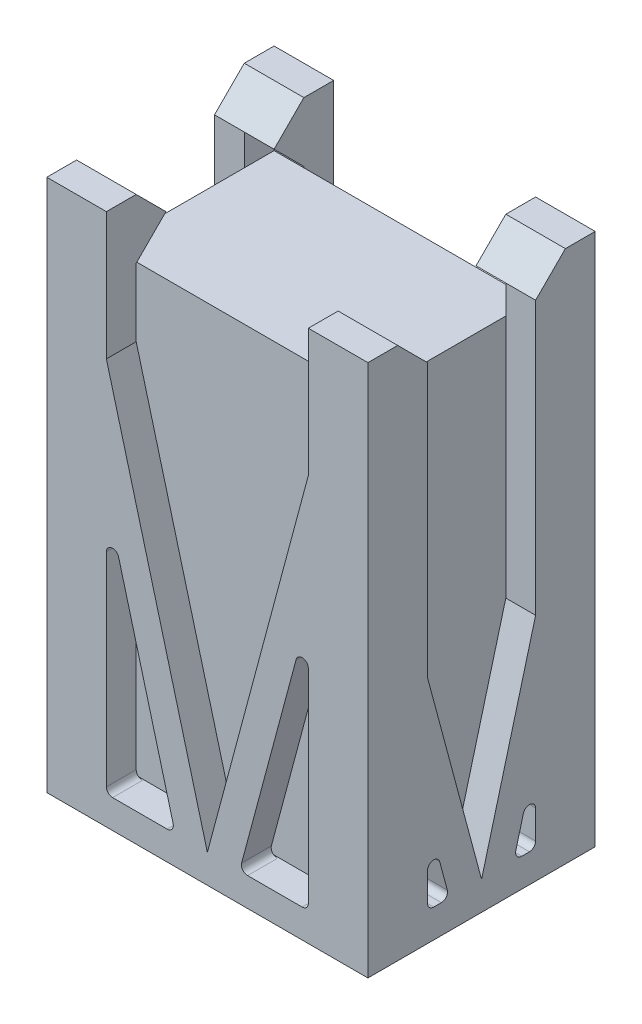
from build123d import *

# Parameters (mm, degrees)
SKETCH1_W                                 = 32.850000086
SKETCH1_H                                 = 23.249999982
BOSS_EXTRUDE1_DEPTH                       = 3.175
SKETCH2_W                                 = 26.500000086
SKETCH2_H                                 = 16.899999982
BATTERY_DEPTH                             = 45.499999932
CSK_FOR_4_FLAT_HEAD_MACHINE_SCREW_2_COUNT = 2
CSK_FOR_4_FLAT_HEAD_MACHINE_SCREW_2_PITCH = 19.05
BOSS_EXTRUDE4_DEPTH                       = 45.499999932
RIB1_START                                = -3.048
RIB1_DEPTH                                = 3.048
CUT_EXTRUDE1_DEPTH                        = 3.048
MIRROR2_START                             = -3.048
MIRROR2_COPY_1_DEPTH                      = 3.048
MIRROR2_COPY_2_DEPTH                      = 3.048
BOSS_EXTRUDE5_REACH                       = 61.862
BOSS_EXTRUDE6_DEPTH                       = 3.048
BOSS_EXTRUDE7_DEPTH                       = 6.096
BOSS_EXTRUDE8_DEPTH                       = 3.048
RIB4_REACH                                = 66.916
SKETCH22_WALL_W                           = 153.195008736
SKETCH22_WALL_H                           = 3.048
CUT_EXTRUDE2_DEPTH                        = 3.048
MIRROR7_COPY_1_REACH                      = 66.916
MIRROR7_COPY_1_SKETCH_W                   = 153.195008736
MIRROR7_COPY_1_SKETCH_H                   = 3.048
MIRROR7_COPY_2_DEPTH                      = 3.048
FILLET2_R                                 = 0.635
CHAMFER_FOR_ELEPHANT_S_FOOT_SIZE          = 0.254


# Read off the part's stored shape, not the designer's step: Rib1
with BuildPart() as part:
    # Sketch1 → Boss-Extrude1 (new body)
    with BuildSketch(Plane(origin=(0, 0, 0), x_dir=(1, 0, 0), z_dir=(0, 1, 0))):
        Rectangle(SKETCH1_W, SKETCH1_H)
    extrude(amount=BOSS_EXTRUDE1_DEPTH)

    # Sketch13 → CSK for _4 Flat Head Machine Screw _100 (revolve, cut)
    with BuildSketch(Plane(origin=(-9.525, 3.175, 0), x_dir=(0, 0, 1), z_dir=(1, 0, 0))):
        Polygon((0, 0), (0, 3.175), (1.63195, 3.175), (1.63195, 1.028358553), (2.8575, 0), align=None)
    csk_for_4_flat_head_machine_screw_100 = revolve(axis=Axis((-9.525, 9.525, 0), (0, -1, 0)), mode=Mode.SUBTRACT)

    # CSK for _4 Flat Head Machine Screw _ 2: CSK for _4 Flat Head Machine Screw _100 ×2
    with Locations(*[(i * CSK_FOR_4_FLAT_HEAD_MACHINE_SCREW_2_PITCH, 0, 0) for i in range(1, CSK_FOR_4_FLAT_HEAD_MACHINE_SCREW_2_COUNT)]):
        add(csk_for_4_flat_head_machine_screw_100, mode=Mode.SUBTRACT)

    # Sketch14 → Boss-Extrude4 (add)
    with BuildSketch(Plane(origin=(0, 3.175, 0), x_dir=(1, 0, 0), z_dir=(0, 1, 0))):
        Polygon((16.425000043, -11.624999991), (16.425000043, -5.528999991), (13.377000043, -5.528999991), (13.377000043, -8.576999991), (10.329000043, -8.576999991), (10.329000043, -11.624999991), align=None)
        Polygon((13.377000043, 8.576999991), (13.377000043, 5.528999991), (16.425000043, 5.528999991), (16.425000043, 11.624999991), (10.329000043, 11.624999991), (10.329000043, 8.576999991), align=None)
        Polygon((-10.329000043, 8.576999991), (-10.329000043, 11.624999991), (-16.425000043, 11.624999991), (-16.425000043, 5.528999991), (-13.377000043, 5.528999991), (-13.377000043, 8.576999991), align=None)
        Polygon((-16.425000043, -11.624999991), (-10.329000043, -11.624999991), (-10.329000043, -8.576999991), (-13.377000043, -8.576999991), (-13.377000043, -5.528999991), (-16.425000043, -5.528999991), align=None)
    extrude(amount=BOSS_EXTRUDE4_DEPTH)

    # Rib1 outline → Rib1 (add)
    with BuildSketch(Plane.XY.offset(11.624999991).offset(RIB1_START)):
        Polygon((-10.329000043, 3.175), (0, 3.175), (-10.329000043, 41.723352952), align=None)
    rib1 = extrude(amount=RIB1_DEPTH)

    # Sketch18 → Cut-Extrude1 (cut)
    with BuildSketch(Plane(origin=(0, 0, 8.576999991), x_dir=(-1, 0, 0), z_dir=(0, 0, -1))):
        Polygon((10.329000043, 29.456094958), (10.329000043, 3.175), (3.287001873, 3.175), align=None)
    cut_extrude1 = extrude(amount=-CUT_EXTRUDE1_DEPTH, mode=Mode.SUBTRACT)

    # Mirror1: Rib1, Cut-Extrude1 across plane
    add(rib1.mirror(Plane.XY))
    add(cut_extrude1.mirror(Plane.XY), mode=Mode.SUBTRACT)

    # Mirror2: Rib1, Cut-Extrude1 across plane
    add(rib1.mirror(Plane(origin=(0, 0, 0), x_dir=(0, 0, 1), z_dir=(1, 0, 0))))
    add(cut_extrude1.mirror(Plane(origin=(0, 0, 0), x_dir=(0, 0, 1), z_dir=(1, 0, 0))), mode=Mode.SUBTRACT)

    # Mirror2 copy 1 sketch → Mirror2 copy 1 (add)
    with BuildSketch(Plane(origin=(0, 0, -11.624999991), x_dir=(-1, 0, 0), z_dir=(0, 0, -1)).offset(MIRROR2_START)):
        Polygon((-10.329000043, 3.175), (0, 3.175), (-10.329000043, 41.723352952), align=None)
    extrude(amount=MIRROR2_COPY_1_DEPTH)

    # Mirror2 copy 2 sketch → Mirror2 copy 2 (cut)
    with BuildSketch(Plane.XY.offset(-8.576999991)):
        Polygon((10.329000043, 29.456094958), (10.329000043, 3.175), (3.287001873, 3.175), align=None)
    extrude(amount=-MIRROR2_COPY_2_DEPTH, mode=Mode.SUBTRACT)

    # Boss-Extrude5: up to this face of the body (flat: up to its plane)
    boss_extrude5_end = Plane(part.part.faces().sort_by_distance((10.329000043, 45.199176442, 10.100999991))[0])
    # Sketch19 → Boss-Extrude5 (add, up to the picked face)
    with BuildSketch(Plane.ZY.offset(-16.425000043), mode=Mode.PRIVATE) as boss_extrude5_sk1:
        Polygon((5.528999991, 51.722999932), (8.576999991, 48.674999932), (11.624999991, 48.674999932), (11.624999991, 51.722999932), align=None)
    boss_extrude5_tool1 = split(extrude(boss_extrude5_sk1.sketch, amount=BOSS_EXTRUDE5_REACH, mode=Mode.PRIVATE), bisect_by=boss_extrude5_end, keep=Keep.BOTH, mode=Mode.PRIVATE)
    # Sketch19 → Boss-Extrude5 (add, up to the picked face)
    with BuildSketch(Plane.ZY.offset(-16.425000043), mode=Mode.PRIVATE) as boss_extrude5_sk2:
        Polygon((8.576999991, 54.770999932), (5.528999991, 51.722999932), (11.624999991, 51.722999932), (11.624999991, 54.770999932), align=None)
    boss_extrude5_tool2 = split(extrude(boss_extrude5_sk2.sketch, amount=BOSS_EXTRUDE5_REACH, mode=Mode.PRIVATE), bisect_by=boss_extrude5_end, keep=Keep.BOTH, mode=Mode.PRIVATE)
    boss_extrude5_1 = boss_extrude5_tool1.solids().sort_by(Axis((16.425, 50.368333, 9.254333), (-1, 0, 0)))[0]
    add(boss_extrude5_1)
    boss_extrude5_2 = boss_extrude5_tool2.solids().sort_by(Axis((16.425, 53.077667, 9.254333), (-1, 0, 0)))[0]
    add(boss_extrude5_2)
    boss_extrude5 = boss_extrude5_1 + boss_extrude5_2  # Boss-Extrude5 as one shape, for the pattern or mirror that repeats it

    # Sketch19<3> → Boss-Extrude6 (add)
    with BuildSketch(Plane.ZY.offset(-16.425000043)):
        Polygon((5.528999991, 48.674999932), (8.576999991, 48.674999932), (5.528999991, 51.722999932), align=None)
    boss_extrude6 = extrude(amount=BOSS_EXTRUDE6_DEPTH)

    # Sketch20 → Boss-Extrude7 (add)
    with BuildSketch(Plane.ZY.offset(16.425000043)):
        Polygon((8.576999991, 54.770999932), (5.528999991, 51.722999932), (8.576999991, 48.674999932), (11.624999991, 48.674999932), (11.624999991, 54.770999932), align=None)
    boss_extrude7 = extrude(amount=-BOSS_EXTRUDE7_DEPTH)

    # Sketch20<3> → Boss-Extrude8 (add)
    with BuildSketch(Plane.ZY.offset(16.425000043)):
        Polygon((5.528999991, 51.722999932), (5.528999991, 48.674999932), (8.576999991, 48.674999932), align=None)
    boss_extrude8 = extrude(amount=-BOSS_EXTRUDE8_DEPTH)

    # Mirror3: Boss-Extrude5, Boss-Extrude6, Boss-Extrude7, Boss-Extrude8 across plane
    add(boss_extrude5.mirror(Plane.XY))
    add(boss_extrude6.mirror(Plane.XY))
    add(boss_extrude7.mirror(Plane.XY))
    add(boss_extrude8.mirror(Plane.XY))

    # Sketch22 wall → Rib4 (add, up to next)
    with BuildSketch(Plane(origin=(16.425000043, 13.492254441, 2.764499996), x_dir=(0, 0.965925826288, 0.258819045108), z_dir=(0, -0.258819045108, 0.965925826288)), mode=Mode.PRIVATE) as rib4_sk1:
        with Locations((0, 1.524)):
            Rectangle(SKETCH22_WALL_W, SKETCH22_WALL_H)
    rib4_tool1 = extrude(rib4_sk1.sketch, amount=RIB4_REACH, mode=Mode.PRIVATE) - part.part
    rib4 = rib4_tool1.solids().sort_by_distance((16.425000043, 13.492254441, 2.764499996))[0]
    add(rib4)

    # Sketch23 → Cut-Extrude2 (cut)
    with BuildSketch(Plane(origin=(16.425000043, 0, 0), x_dir=(0, 0, -1), z_dir=(1, 0, 0))):
        Polygon((-5.528999991, 3.175), (-3.287001873, 3.175), (-5.528999991, 11.542250888), align=None)
    cut_extrude2 = extrude(amount=-CUT_EXTRUDE2_DEPTH, mode=Mode.SUBTRACT)

    # Mirror6: Rib4, Cut-Extrude2 across plane
    add(rib4.mirror(Plane(origin=(0, 0, 0), x_dir=(0, 0, 1), z_dir=(1, 0, 0))))
    add(cut_extrude2.mirror(Plane(origin=(0, 0, 0), x_dir=(0, 0, 1), z_dir=(1, 0, 0))), mode=Mode.SUBTRACT)

    # Mirror7: Rib4, Cut-Extrude2 across plane
    add(rib4.mirror(Plane.XY))
    add(cut_extrude2.mirror(Plane.XY), mode=Mode.SUBTRACT)

    # Mirror7 copy 1 sketch → Mirror7 copy 1 (add, up to next)
    with BuildSketch(Plane(origin=(-16.425000043, 13.492254441, -2.764499996), x_dir=(0, 0.965925826288, -0.258819045108), z_dir=(0, -0.258819045108, -0.965925826288)), mode=Mode.PRIVATE) as mirror7_copy_1_sk1:
        with Locations((0, 1.524)):
            Rectangle(MIRROR7_COPY_1_SKETCH_W, MIRROR7_COPY_1_SKETCH_H)
    mirror7_copy_1_tool1 = extrude(mirror7_copy_1_sk1.sketch, amount=MIRROR7_COPY_1_REACH, mode=Mode.PRIVATE) - part.part
    add(mirror7_copy_1_tool1.solids().sort_by_distance((-16.425000043, 13.492254441, -2.764499996))[0])

    # Mirror7 copy 2 sketch → Mirror7 copy 2 (cut)
    with BuildSketch(Plane.ZY.offset(16.425000043)):
        Polygon((-5.528999991, 3.175), (-3.287001873, 3.175), (-5.528999991, 11.542250888), align=None)
    extrude(amount=-MIRROR7_COPY_2_DEPTH, mode=Mode.SUBTRACT)

    # Fillet2
    fillet2_edges = [part.edges().sort_by_distance(p)[0] for p in [
        (-3.287001873, 3.175, 10.100999991),
        (-10.329000043, 29.456094958, 10.100999991),
        (-10.329000043, 3.175, 10.100999991),
        (0, 3.175, -10.100999991),
        (-10.329000043, 29.456094958, -10.100999991),
        (-3.287001873, 3.175, -10.100999991),
        (-10.329000043, 3.175, -10.100999991),
        (10.329000043, 29.456094958, 10.100999991),
        (3.287001873, 3.175, 10.100999991),
        (10.329000043, 3.175, 10.100999991),
        (3.287001873, 3.175, -10.100999991),
        (10.329000043, 29.456094958, -10.100999991),
        (10.329000043, 3.175, -10.100999991),
        (14.901000043, 3.175, 5.528999991),
        (14.901000043, 11.542250888, 5.528999991),
        (14.901000043, 3.175, 3.287001873),
        (-14.901000043, 11.542250888, 5.528999991),
        (-14.901000043, 3.175, 5.528999991),
        (-14.901000043, 3.175, 3.287001873),
        (-14.901000043, 3.175, -5.528999991),
        (-14.901000043, 11.542250888, -5.528999991),
        (-14.901000043, 3.175, -3.287001873),
        (14.901000043, 11.542250888, -5.528999991),
        (14.901000043, 3.175, -5.528999991),
        (14.901000043, 3.175, -3.287001873),
    ]]
    fillet(fillet2_edges, radius=FILLET2_R)

    # Chamfer for Elephant's foot
    chamfer_for_elephant_s_foot_edges = [part.edges().sort_by_distance(p)[0] for p in [
        (0, 0, -11.624999991),
        (16.425000043, 0, 0),
        (0, 0, 11.624999991),
        (-16.425000043, 0, 0),
    ]]
    chamfer(chamfer_for_elephant_s_foot_edges, length=CHAMFER_FOR_ELEPHANT_S_FOOT_SIZE)


with BuildPart() as body_2:
    # Sketch2 → Battery (new body)
    with BuildSketch(Plane(origin=(0, 3.175, 0), x_dir=(1, 0, 0), z_dir=(0, 1, 0))):
        Rectangle(SKETCH2_W, SKETCH2_H)
    extrude(amount=BATTERY_DEPTH)


solid = Compound([part.part, body_2.part])
